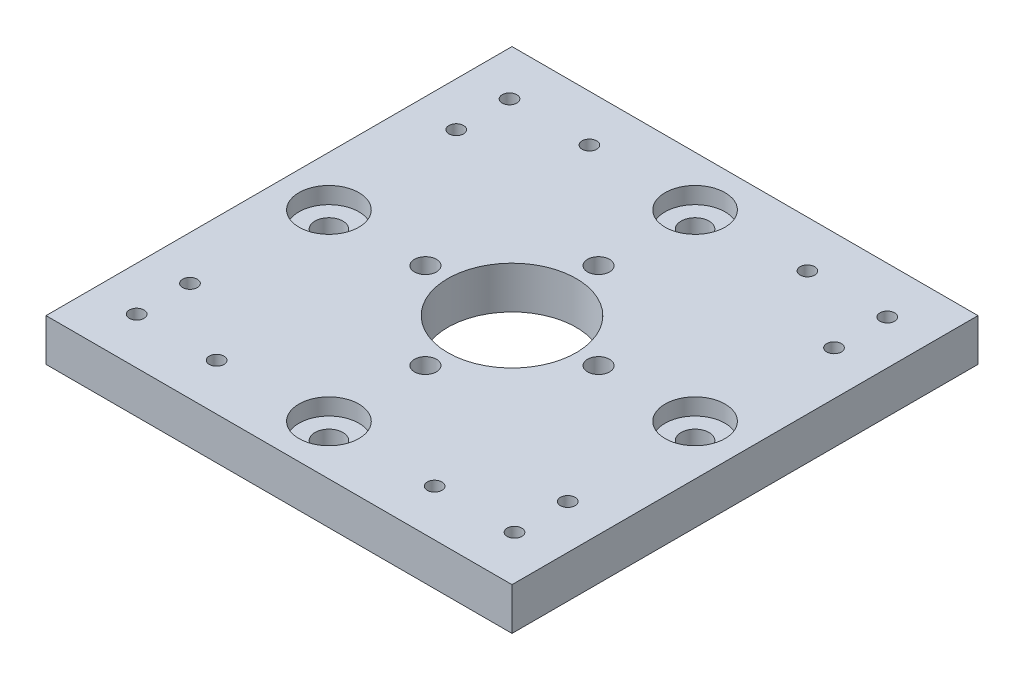
from build123d import *

# Parameters (mm, degrees)
SKETCH1_W           = 70
SKETCH1_H           = 70
SKETCH1_R           = 1.65
BOSS_EXTRUDE1_DEPTH = 6.35
CUT_EXTRUDE1_REACH  = 51.903
SKETCH2_R           = 1.1
CUT_EXTRUDE2_REACH  = 51.903
SKETCH3_R           = 9.65
CUT_EXTRUDE3_REACH  = 51.903
SKETCH4_R           = 2.1
SKETCH5_R           = 4.5
CUT_EXTRUDE4_DEPTH  = 2.5


with BuildPart() as part:
    # Sketch1 → Boss-Extrude1 (new body)
    with BuildSketch(Plane(origin=(0, 0, 0), x_dir=(1, 0, 0), z_dir=(0, 1, 0))):
        Rectangle(SKETCH1_W, SKETCH1_H)
        with Locations((0, 13)):
            Circle(SKETCH1_R, mode=Mode.SUBTRACT)
        with Locations((-13, 0)):
            Circle(SKETCH1_R, mode=Mode.SUBTRACT)
        with Locations((0, -13)):
            Circle(SKETCH1_R, mode=Mode.SUBTRACT)
        with Locations((13, 0)):
            Circle(SKETCH1_R, mode=Mode.SUBTRACT)
    extrude(amount=BOSS_EXTRUDE1_DEPTH)

    # Sketch2 → Cut-Extrude1 (cut, up to next)
    with BuildSketch(Plane(origin=(0, 6.35, 0), x_dir=(1, 0, 0), z_dir=(0, 1, 0)), mode=Mode.PRIVATE) as cut_extrude1_sk1:
        with Locations((16.375, 28)):
            Circle(SKETCH2_R)
    cut_extrude1_tool1 = extrude(cut_extrude1_sk1.sketch, amount=-CUT_EXTRUDE1_REACH, mode=Mode.PRIVATE) & part.part
    # Sketch2 → Cut-Extrude1 (cut, up to next)
    with BuildSketch(Plane(origin=(0, 6.35, 0), x_dir=(1, 0, 0), z_dir=(0, 1, 0)), mode=Mode.PRIVATE) as cut_extrude1_sk2:
        with Locations((28.375, 28)):
            Circle(SKETCH2_R)
    cut_extrude1_tool2 = extrude(cut_extrude1_sk2.sketch, amount=-CUT_EXTRUDE1_REACH, mode=Mode.PRIVATE) & part.part
    # Sketch2 → Cut-Extrude1 (cut, up to next)
    with BuildSketch(Plane(origin=(0, 6.35, 0), x_dir=(1, 0, 0), z_dir=(0, 1, 0)), mode=Mode.PRIVATE) as cut_extrude1_sk3:
        with Locations((28.375, 20)):
            Circle(SKETCH2_R)
    cut_extrude1_tool3 = extrude(cut_extrude1_sk3.sketch, amount=-CUT_EXTRUDE1_REACH, mode=Mode.PRIVATE) & part.part
    # Sketch2 → Cut-Extrude1 (cut, up to next)
    with BuildSketch(Plane(origin=(0, 6.35, 0), x_dir=(1, 0, 0), z_dir=(0, 1, 0)), mode=Mode.PRIVATE) as cut_extrude1_sk4:
        with Locations((-28.375, 20)):
            Circle(SKETCH2_R)
    cut_extrude1_tool4 = extrude(cut_extrude1_sk4.sketch, amount=-CUT_EXTRUDE1_REACH, mode=Mode.PRIVATE) & part.part
    # Sketch2 → Cut-Extrude1 (cut, up to next)
    with BuildSketch(Plane(origin=(0, 6.35, 0), x_dir=(1, 0, 0), z_dir=(0, 1, 0)), mode=Mode.PRIVATE) as cut_extrude1_sk5:
        with Locations((-28.375, 28)):
            Circle(SKETCH2_R)
    cut_extrude1_tool5 = extrude(cut_extrude1_sk5.sketch, amount=-CUT_EXTRUDE1_REACH, mode=Mode.PRIVATE) & part.part
    # Sketch2 → Cut-Extrude1 (cut, up to next)
    with BuildSketch(Plane(origin=(0, 6.35, 0), x_dir=(1, 0, 0), z_dir=(0, 1, 0)), mode=Mode.PRIVATE) as cut_extrude1_sk6:
        with Locations((-16.375, 28)):
            Circle(SKETCH2_R)
    cut_extrude1_tool6 = extrude(cut_extrude1_sk6.sketch, amount=-CUT_EXTRUDE1_REACH, mode=Mode.PRIVATE) & part.part
    # Sketch2 → Cut-Extrude1 (cut, up to next)
    with BuildSketch(Plane(origin=(0, 6.35, 0), x_dir=(1, 0, 0), z_dir=(0, 1, 0)), mode=Mode.PRIVATE) as cut_extrude1_sk7:
        with Locations((28.375, -20)):
            Circle(SKETCH2_R)
    cut_extrude1_tool7 = extrude(cut_extrude1_sk7.sketch, amount=-CUT_EXTRUDE1_REACH, mode=Mode.PRIVATE) & part.part
    # Sketch2 → Cut-Extrude1 (cut, up to next)
    with BuildSketch(Plane(origin=(0, 6.35, 0), x_dir=(1, 0, 0), z_dir=(0, 1, 0)), mode=Mode.PRIVATE) as cut_extrude1_sk8:
        with Locations((28.375, -28)):
            Circle(SKETCH2_R)
    cut_extrude1_tool8 = extrude(cut_extrude1_sk8.sketch, amount=-CUT_EXTRUDE1_REACH, mode=Mode.PRIVATE) & part.part
    # Sketch2 → Cut-Extrude1 (cut, up to next)
    with BuildSketch(Plane(origin=(0, 6.35, 0), x_dir=(1, 0, 0), z_dir=(0, 1, 0)), mode=Mode.PRIVATE) as cut_extrude1_sk9:
        with Locations((16.375, -28)):
            Circle(SKETCH2_R)
    cut_extrude1_tool9 = extrude(cut_extrude1_sk9.sketch, amount=-CUT_EXTRUDE1_REACH, mode=Mode.PRIVATE) & part.part
    # Sketch2 → Cut-Extrude1 (cut, up to next)
    with BuildSketch(Plane(origin=(0, 6.35, 0), x_dir=(1, 0, 0), z_dir=(0, 1, 0)), mode=Mode.PRIVATE) as cut_extrude1_sk10:
        with Locations((-16.375, -28)):
            Circle(SKETCH2_R)
    cut_extrude1_tool10 = extrude(cut_extrude1_sk10.sketch, amount=-CUT_EXTRUDE1_REACH, mode=Mode.PRIVATE) & part.part
    # Sketch2 → Cut-Extrude1 (cut, up to next)
    with BuildSketch(Plane(origin=(0, 6.35, 0), x_dir=(1, 0, 0), z_dir=(0, 1, 0)), mode=Mode.PRIVATE) as cut_extrude1_sk11:
        with Locations((-28.375, -20)):
            Circle(SKETCH2_R)
    cut_extrude1_tool11 = extrude(cut_extrude1_sk11.sketch, amount=-CUT_EXTRUDE1_REACH, mode=Mode.PRIVATE) & part.part
    # Sketch2 → Cut-Extrude1 (cut, up to next)
    with BuildSketch(Plane(origin=(0, 6.35, 0), x_dir=(1, 0, 0), z_dir=(0, 1, 0)), mode=Mode.PRIVATE) as cut_extrude1_sk12:
        with Locations((-28.375, -28)):
            Circle(SKETCH2_R)
    cut_extrude1_tool12 = extrude(cut_extrude1_sk12.sketch, amount=-CUT_EXTRUDE1_REACH, mode=Mode.PRIVATE) & part.part
    add(cut_extrude1_tool1.solids().sort_by_distance((16.375, 6.35, -28))[0], mode=Mode.SUBTRACT)
    add(cut_extrude1_tool2.solids().sort_by_distance((28.375, 6.35, -28))[0], mode=Mode.SUBTRACT)
    add(cut_extrude1_tool3.solids().sort_by_distance((28.375, 6.35, -20))[0], mode=Mode.SUBTRACT)
    add(cut_extrude1_tool4.solids().sort_by_distance((-28.375, 6.35, -20))[0], mode=Mode.SUBTRACT)
    add(cut_extrude1_tool5.solids().sort_by_distance((-28.375, 6.35, -28))[0], mode=Mode.SUBTRACT)
    add(cut_extrude1_tool6.solids().sort_by_distance((-16.375, 6.35, -28))[0], mode=Mode.SUBTRACT)
    add(cut_extrude1_tool7.solids().sort_by_distance((28.375, 6.35, 20))[0], mode=Mode.SUBTRACT)
    add(cut_extrude1_tool8.solids().sort_by_distance((28.375, 6.35, 28))[0], mode=Mode.SUBTRACT)
    add(cut_extrude1_tool9.solids().sort_by_distance((16.375, 6.35, 28))[0], mode=Mode.SUBTRACT)
    add(cut_extrude1_tool10.solids().sort_by_distance((-16.375, 6.35, 28))[0], mode=Mode.SUBTRACT)
    add(cut_extrude1_tool11.solids().sort_by_distance((-28.375, 6.35, 20))[0], mode=Mode.SUBTRACT)
    add(cut_extrude1_tool12.solids().sort_by_distance((-28.375, 6.35, 28))[0], mode=Mode.SUBTRACT)

    # Sketch3 → Cut-Extrude2 (cut, up to next)
    with BuildSketch(Plane(origin=(0, 6.35, 0), x_dir=(1, 0, 0), z_dir=(0, 1, 0)), mode=Mode.PRIVATE) as cut_extrude2_sk1:
        Circle(SKETCH3_R)
    cut_extrude2_tool1 = extrude(cut_extrude2_sk1.sketch, amount=-CUT_EXTRUDE2_REACH, mode=Mode.PRIVATE) & part.part
    add(cut_extrude2_tool1.solids().sort_by_distance((0, 6.35, 0))[0], mode=Mode.SUBTRACT)

    # Sketch4 → Cut-Extrude3 (cut, up to next)
    with BuildSketch(Plane(origin=(0, 6.35, 0), x_dir=(1, 0, 0), z_dir=(0, 1, 0)), mode=Mode.PRIVATE) as cut_extrude3_sk1:
        with Locations((27.5, 0)):
            Circle(SKETCH4_R)
    cut_extrude3_tool1 = extrude(cut_extrude3_sk1.sketch, amount=-CUT_EXTRUDE3_REACH, mode=Mode.PRIVATE) & part.part
    # Sketch4 → Cut-Extrude3 (cut, up to next)
    with BuildSketch(Plane(origin=(0, 6.35, 0), x_dir=(1, 0, 0), z_dir=(0, 1, 0)), mode=Mode.PRIVATE) as cut_extrude3_sk2:
        with Locations((0, 27.5)):
            Circle(SKETCH4_R)
    cut_extrude3_tool2 = extrude(cut_extrude3_sk2.sketch, amount=-CUT_EXTRUDE3_REACH, mode=Mode.PRIVATE) & part.part
    # Sketch4 → Cut-Extrude3 (cut, up to next)
    with BuildSketch(Plane(origin=(0, 6.35, 0), x_dir=(1, 0, 0), z_dir=(0, 1, 0)), mode=Mode.PRIVATE) as cut_extrude3_sk3:
        with Locations((0, -27.5)):
            Circle(SKETCH4_R)
    cut_extrude3_tool3 = extrude(cut_extrude3_sk3.sketch, amount=-CUT_EXTRUDE3_REACH, mode=Mode.PRIVATE) & part.part
    # Sketch4 → Cut-Extrude3 (cut, up to next)
    with BuildSketch(Plane(origin=(0, 6.35, 0), x_dir=(1, 0, 0), z_dir=(0, 1, 0)), mode=Mode.PRIVATE) as cut_extrude3_sk4:
        with Locations((-27.5, 0)):
            Circle(SKETCH4_R)
    cut_extrude3_tool4 = extrude(cut_extrude3_sk4.sketch, amount=-CUT_EXTRUDE3_REACH, mode=Mode.PRIVATE) & part.part
    add(cut_extrude3_tool1.solids().sort_by_distance((27.5, 6.35, 0))[0], mode=Mode.SUBTRACT)
    add(cut_extrude3_tool2.solids().sort_by_distance((0, 6.35, -27.5))[0], mode=Mode.SUBTRACT)
    add(cut_extrude3_tool3.solids().sort_by_distance((0, 6.35, 27.5))[0], mode=Mode.SUBTRACT)
    add(cut_extrude3_tool4.solids().sort_by_distance((-27.5, 6.35, 0))[0], mode=Mode.SUBTRACT)

    # Sketch5 → Cut-Extrude4 (cut)
    with BuildSketch(Plane(origin=(0, 6.35, 0), x_dir=(1, 0, 0), z_dir=(0, 1, 0))):
        with Locations((0, 27.5)):
            Circle(SKETCH5_R)
        with Locations((27.5, 0)):
            Circle(SKETCH5_R)
        with Locations((0, -27.5)):
            Circle(SKETCH5_R)
        with Locations((-27.5, 0)):
            Circle(SKETCH5_R)
    extrude(amount=-CUT_EXTRUDE4_DEPTH, mode=Mode.SUBTRACT)


solid = part.part
